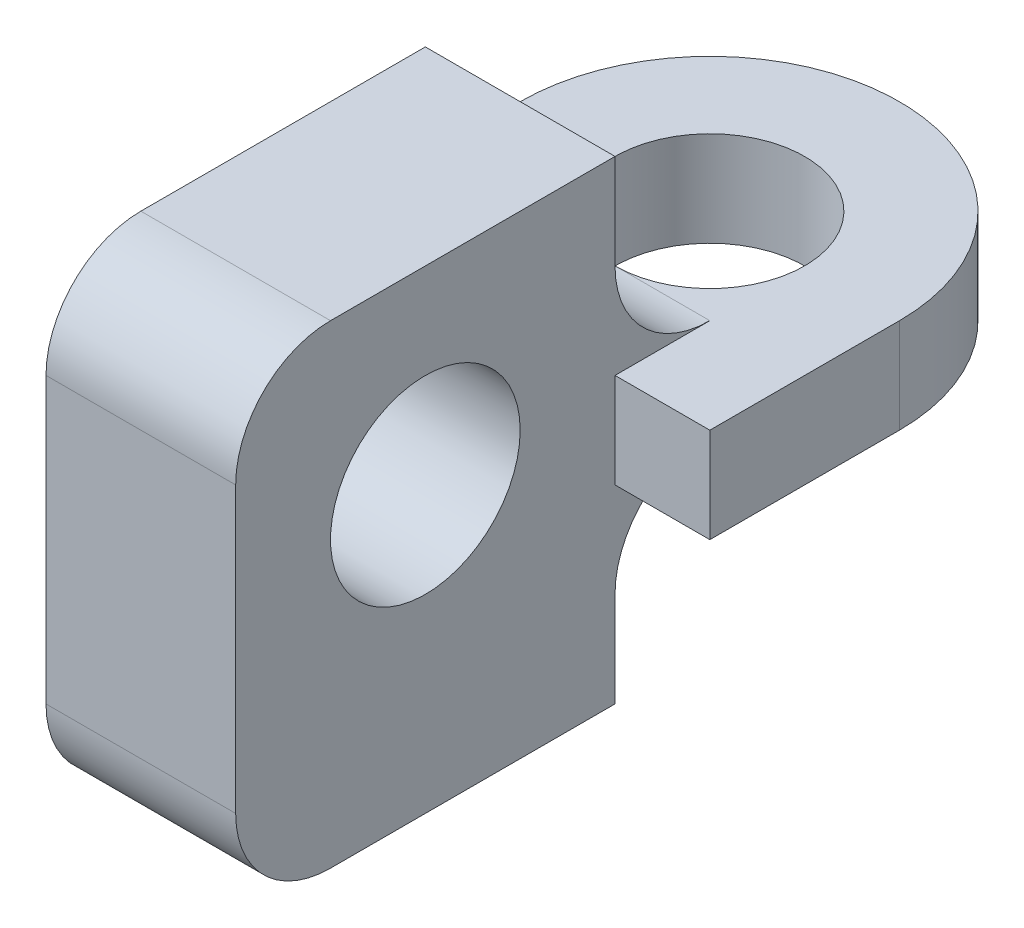
from build123d import *

# Parameters (mm, degrees)
SALIENTE_EXTRUIR1_DEPTH = 20
CROQUIS2_R              = 10
CORTAR_EXTRUIR1_DEPTH   = 20
SALIENTE_EXTRUIR2_DEPTH = 10
CROQUIS8_R              = 9.999999999999998
CORTAR_EXTRUIR2_DEPTH   = 10
REDONDEO3_R             = 10
REDONDEO4_R             = 10


with BuildPart() as part:
    # Croquis1 → Saliente-Extruir1 (new body)
    with BuildSketch(Plane(origin=(0, 0, 0), x_dir=(0, 0, -1), z_dir=(1, 0, 0))):
        with BuildLine():
            Line((10.000000000000071, 0), (40, 0))
            Line((40, 0), (40, 50))
            Line((40, 50), (10.000000000000071, 50))
            ThreePointArc((10.000000000000071, 50), (2.928932188134529, 47.071067811865476), (0, 39.99999999999993))
            Line((0, 39.99999999999993), (0, 10.000000000000071))
            ThreePointArc((0, 10.000000000000071), (2.9289321881345227, 2.9289321881345245), (10.000000000000071, 0))
        make_face()
    extrude(amount=SALIENTE_EXTRUIR1_DEPTH)

    # Croquis2 → Cortar-Extruir1 (cut)
    with BuildSketch(Plane(origin=(20, 0, 0), x_dir=(0, 0, -1), z_dir=(1, 0, 0))):
        with Locations((20.000000000000004, 30.000000000000004)):
            Circle(CROQUIS2_R)
    extrude(amount=-CORTAR_EXTRUIR1_DEPTH, mode=Mode.SUBTRACT)

    # Croquis6 → Saliente-Extruir2 (add)
    with BuildSketch(Plane(origin=(0, 30.000000000000004, 0), x_dir=(1, 0, 0), z_dir=(0, 1, 0))):
        with BuildLine():
            Line((-9.999999999999996, 60), (-9.999999999999996, 40))
            Line((-9.999999999999996, 40), (30, 40))
            Line((30, 40), (30, 60))
            ThreePointArc((30, 60), (10.000000000000002, 80), (-9.999999999999996, 60))
        make_face()
    extrude(amount=-SALIENTE_EXTRUIR2_DEPTH)

    # Croquis8 → Cortar-Extruir2 (cut)
    with BuildSketch(Plane(origin=(0, 30.000000000000004, 0), x_dir=(1, 0, 0), z_dir=(0, 1, 0))):
        with Locations((10.000000000000002, 60)):
            Circle(CROQUIS8_R)
    extrude(amount=-CORTAR_EXTRUIR2_DEPTH, mode=Mode.SUBTRACT)

    # Redondeo3
    redondeo3_edges = [part.edges().sort_by_distance(p)[0] for p in [
        (10, 30.000000000000004, -40),
    ]]
    fillet(redondeo3_edges, radius=REDONDEO3_R)

    # Redondeo4
    redondeo4_edges = [part.edges().sort_by_distance(p)[0] for p in [
        (10, 20.000000000000004, -40),
    ]]
    fillet(redondeo4_edges, radius=REDONDEO4_R)


solid = part.part
